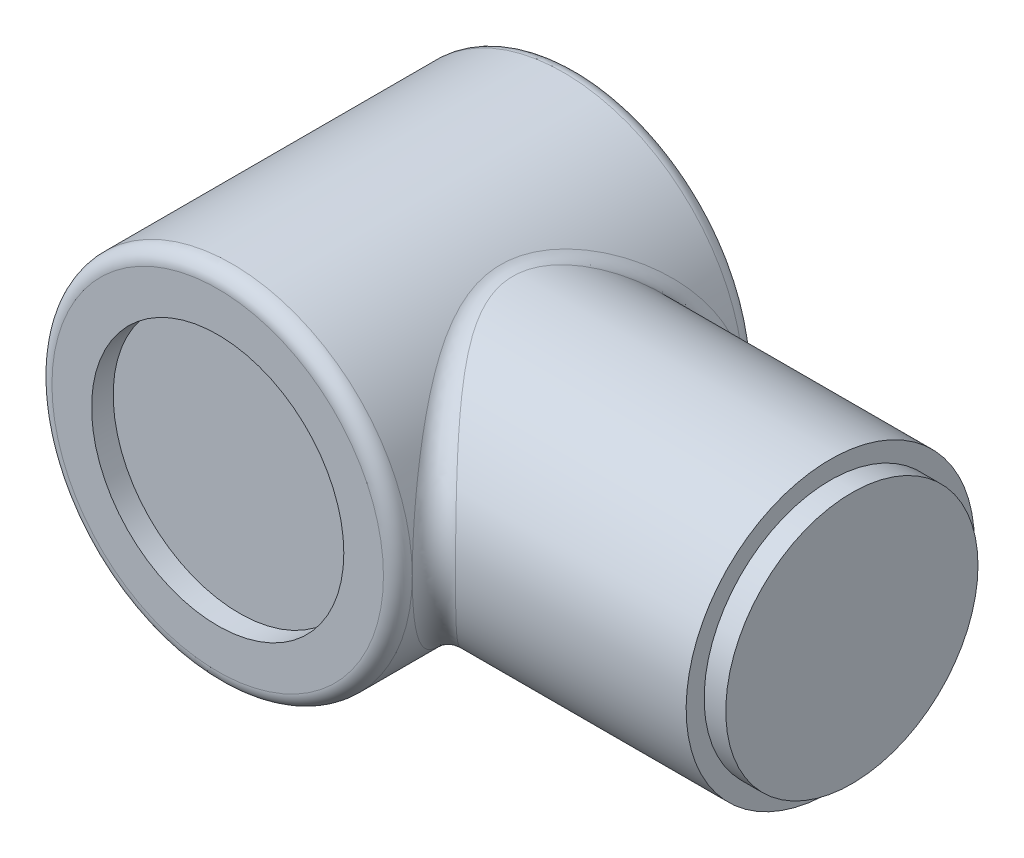
from build123d import *

# Parameters (mm, degrees)
SKETCH1_R           = 25
BOSS_EXTRUDE1_DEPTH = 50
SKETCH2_R           = 17.5
CUT_EXTRUDE1_DEPTH  = 3
CUT_EXTRUDE2_START  = -3
SKETCH3_R           = 17.5
CUT_EXTRUDE2_DEPTH  = 3
SKETCH4_R           = 20
BOSS_EXTRUDE2_DEPTH = 60
SKETCH5_R           = 17.5
BOSS_EXTRUDE3_DEPTH = 3
FILLET1_R           = 3
FILLET2_R           = 2


with BuildPart() as part:
    # Sketch1 → Boss-Extrude1 (new body)
    with BuildSketch(Plane.XY):
        Circle(SKETCH1_R)
    extrude(amount=BOSS_EXTRUDE1_DEPTH)

    # Sketch2 → Cut-Extrude1 (cut)
    with BuildSketch(Plane.XY.offset(50)):
        Circle(SKETCH2_R)
    extrude(amount=-CUT_EXTRUDE1_DEPTH, mode=Mode.SUBTRACT)

    # Sketch3 → Cut-Extrude2 (cut)
    with BuildSketch(Plane(origin=(0, 0, 0), x_dir=(-1, 0, 0), z_dir=(0, 0, -1)).offset(CUT_EXTRUDE2_START)):
        with Locations(Location((0, 0, 0), (0, 0, 180))):
            Circle(SKETCH3_R)
    extrude(amount=CUT_EXTRUDE2_DEPTH, mode=Mode.SUBTRACT)

    # Sketch4 → Boss-Extrude2 (add)
    with BuildSketch(Plane(origin=(0, 0, 0), x_dir=(0, 0, -1), z_dir=(1, 0, 0))):
        with Locations((-25, 0)):
            Circle(SKETCH4_R)
    extrude(amount=BOSS_EXTRUDE2_DEPTH)

    # Sketch5 → Boss-Extrude3 (add)
    with BuildSketch(Plane(origin=(60, 0, 0), x_dir=(0, 0, -1), z_dir=(1, 0, 0))):
        with Locations((-25, 0)):
            Circle(SKETCH5_R)
    extrude(amount=BOSS_EXTRUDE3_DEPTH)

    # Fillet1
    fillet1_edges = [part.edges().sort_by_distance(p)[0] for p in [
        (15, 20, 25),
    ]]
    fillet(fillet1_edges, radius=FILLET1_R)

    # Fillet2
    fillet2_edges = [part.edges().sort_by_distance(p)[0] for p in [
        (-25, 0, 0),
        (-25, 0, 50),
    ]]
    fillet(fillet2_edges, radius=FILLET2_R - 0.0001)  # a hair under: the kernel refuses the full size


solid = part.part
